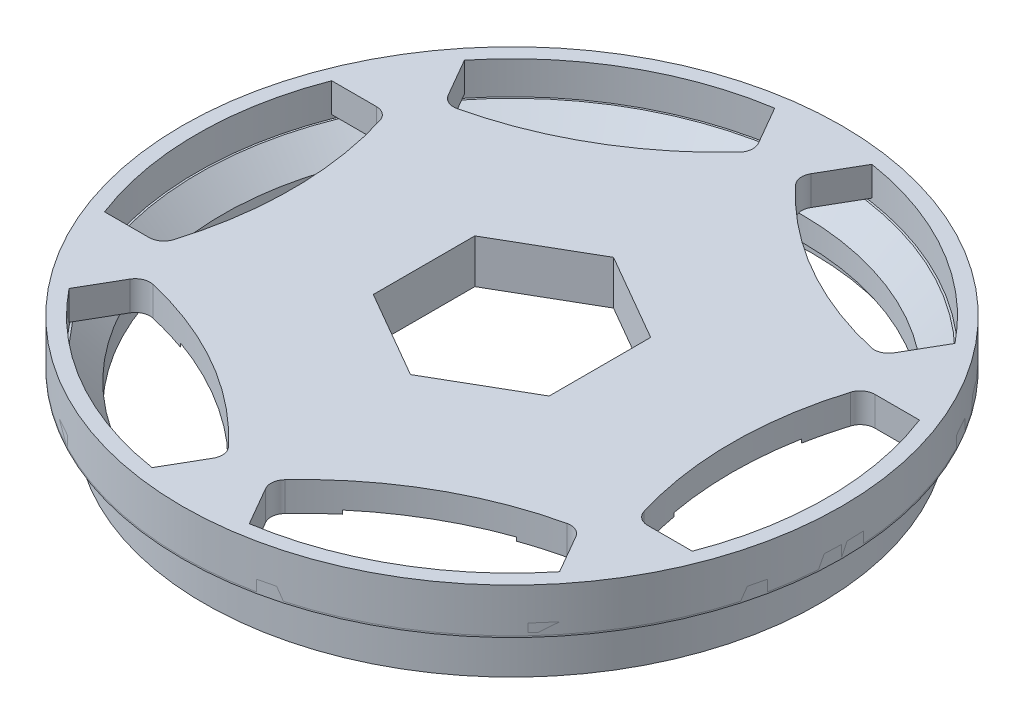
from build123d import *

# Parameters (mm, degrees)
SKIZZE1_R                            = 44
AUFSATZ_LINEAR_AUSTRAGEN1_DEPTH      = 4
SCHNITT_LINEAR_START                 = -10
SCHNITT_LINEAR_AUSTRAGEN2_DEPTH      = 10
SKIZZE4_R                            = 21.007106764
AUFSATZ_LINEAR_AUSTRAGEN4_DEPTH      = 6
KREISMUSTER1_COUNT                   = 6
SCHNITT_LINEAR_AUSTRAGEN3_DEPTH      = 4
SCHNITT_LINEAR_AUSTRAGEN3_DEPTH_BACK = 10
VERRUNDUNG1_R                        = 2
SKIZZE8_R                            = 45
SKIZZE8_R_2                          = 43
AUFSATZ_LINEAR_AUSTRAGEN2_DEPTH      = 6
AUFSATZ_LINEAR_AUSTRAGEN3_DEPTH      = 7
AUFSATZ_LINEAR_AUSTRAGEN3_DEPTH_BACK = 1.5
SKIZZE9_R                            = 45
SKIZZE9_R_2                          = 39.5
FASE1_SIZE                           = 3.25
SKIZZE7_R                            = 32
SKIZZE7_R_2                          = 21.5
SCHNITT_LINEAR_AUSTRAGEN7_DEPTH      = 0.5
SKIZZE10_R                           = 50
SKIZZE10_R_2                         = 42
SCHNITT_LINEAR_AUSTRAGEN9_DEPTH      = 6
SKIZZE11_R                           = 40.9
SKIZZE11_R_2                         = 30
SCHNITT_LINEAR_AUSTRAGEN10_DEPTH     = 2
FASE2_SIZE                           = 0.803847577
FASE2_SIZE_2                         = 3
FASE3_SIZE                           = 2
VERRUNDUNG2_R                        = 1


# Some blends are built 0.0001 mm under size
with BuildPart() as part:
    # Skizze1 → Aufsatz-Linear austragen1 (new body)
    with BuildSketch(Plane(origin=(0, 0, 0), x_dir=(1, 0, 0), z_dir=(0, 1, 0))):
        with Locations(Location((0, 0, 0), (0, 0, 270))):
            Circle(SKIZZE1_R)
    extrude(amount=AUFSATZ_LINEAR_AUSTRAGEN1_DEPTH)

    # Skizze2 → Schnitt-Linear austragen2 (cut)
    with BuildSketch(Plane(origin=(0, 4, 0), x_dir=(1, 0, 0), z_dir=(0, 1, 0)).offset(SCHNITT_LINEAR_START)):
        with BuildLine():
            ThreePointArc((-30, 0), (-30.647234858, 7.855929826), (-32.571484726, 15.5))
            Line((-32.571484726, 15.5), (-41.179485184, 15.5))
            ThreePointArc((-41.179485184, 15.5), (-44, 0), (-41.179485184, -15.5))
            Line((-41.179485184, -15.5), (-32.571484726, -15.5))
            ThreePointArc((-32.571484726, -15.5), (-30.647234858, -7.855929826), (-30, 0))
        make_face()
    schnitt_linear_austragen2 = extrude(amount=SCHNITT_LINEAR_AUSTRAGEN2_DEPTH, mode=Mode.SUBTRACT)

    # Skizze4 → Aufsatz-Linear austragen4 (add)
    with BuildSketch(Plane(origin=(0, 4, 0), x_dir=(1, 0, 0), z_dir=(0, 1, 0))):
        with Locations(Location((0, 0, 0), (0, 0, 270))):
            Circle(SKIZZE4_R)
    extrude(amount=-AUFSATZ_LINEAR_AUSTRAGEN4_DEPTH)

    # Kreismuster1: Schnitt-Linear austragen2 ×6 about axis
    kreismuster1_axis = Axis((0, 0, 0), (0, 1, 0))
    for i in range(1, KREISMUSTER1_COUNT):
        add(schnitt_linear_austragen2.rotate(kreismuster1_axis, i * 360 / KREISMUSTER1_COUNT), mode=Mode.SUBTRACT)

    # Skizze3 → Schnitt-Linear austragen3 (cut, two sides: drawn at the far end of the back side and taken through both)
    with BuildSketch(Plane.XZ.offset(-SCHNITT_LINEAR_AUSTRAGEN3_DEPTH_BACK)):
        Polygon((12, 6.92820323), (0, 13.856406461), (-12, 6.92820323), (-12, -6.92820323), (0, -13.856406461), (12, -6.92820323), align=None)
    extrude(amount=SCHNITT_LINEAR_AUSTRAGEN3_DEPTH + SCHNITT_LINEAR_AUSTRAGEN3_DEPTH_BACK, mode=Mode.SUBTRACT)

    # Verrundung1
    verrundung1_edges = [part.edges().sort_by_distance(p)[0] for p in [
        (-32.571484726, 2, 15.5),
        (-32.571484726, 2, -15.5),
        (-29.709136122, 2, -20.457733212),
        (-2.862348604, 2, -35.957733212),
        (2.862348604, 2, -35.957733212),
        (29.709136122, 2, -20.457733212),
        (32.571484726, 2, -15.5),
        (32.571484726, 2, 15.5),
        (29.709136122, 2, 20.457733212),
        (2.862348604, 2, 35.957733212),
        (-2.862348604, 2, 35.957733212),
        (-29.709136122, 2, 20.457733212),
    ]]
    fillet(verrundung1_edges, radius=VERRUNDUNG1_R)

    # Skizze8 → Aufsatz-Linear austragen2 (add)
    with BuildSketch(Plane(origin=(0, 4, 0), x_dir=(1, 0, 0), z_dir=(0, 1, 0))):
        with Locations(Location((0, 0, 0), (0, 0, 270))):
            Circle(SKIZZE8_R)
        with Locations(Location((0, 0, 0), (0, 0, 270))):
            Circle(SKIZZE8_R_2, mode=Mode.SUBTRACT)
    extrude(amount=-AUFSATZ_LINEAR_AUSTRAGEN2_DEPTH)

    # Skizze7 → Schnitt-Linear austragen7 (cut)
    with BuildSketch(Plane.XZ):
        Circle(SKIZZE7_R)
        with Locations(Location((0, 0, 0), (0, 0, 270))):
            Circle(SKIZZE7_R_2, mode=Mode.SUBTRACT)
    extrude(amount=-SCHNITT_LINEAR_AUSTRAGEN7_DEPTH, mode=Mode.SUBTRACT)

    # Fase3
    fase3_edges = [part.edges().sort_by_distance(p)[0] for p in [
        (0, -2, -21.007106764),
    ]]
    chamfer(fase3_edges, length=FASE3_SIZE - 0.0001)  # a hair under: the kernel refuses the full size


with BuildPart() as body_2:
    # Skizze9 → Aufsatz-Linear austragen3 (new, two sides: drawn at the far end of the back side and taken through both)
    with BuildSketch(Plane.XZ.offset(2).offset(-AUFSATZ_LINEAR_AUSTRAGEN3_DEPTH_BACK)):
        with Locations(Location((0, 0, 0), (0, 0, 270))):
            Circle(SKIZZE9_R)
        with Locations(Location((0, 0, 0), (0, 0, 270))):
            Circle(SKIZZE9_R_2, mode=Mode.SUBTRACT)
    extrude(amount=AUFSATZ_LINEAR_AUSTRAGEN3_DEPTH + AUFSATZ_LINEAR_AUSTRAGEN3_DEPTH_BACK)

    # Fase1
    fase1_edges = [body_2.edges().sort_by_distance(p)[0] for p in [
        (0, -0.5, 39.5),
    ]]
    chamfer(fase1_edges, length=FASE1_SIZE)

    # Skizze10 → Schnitt-Linear austragen9 (cut)
    with BuildSketch(Plane.XZ.offset(9)):
        Circle(SKIZZE10_R)
        with Locations(Location((0, 0, 0), (0, 0, 270))):
            Circle(SKIZZE10_R_2, mode=Mode.SUBTRACT)
    extrude(amount=-SCHNITT_LINEAR_AUSTRAGEN9_DEPTH, mode=Mode.SUBTRACT)

    # Skizze11 → Schnitt-Linear austragen10 (cut)
    with BuildSketch(Plane.XZ.offset(9)):
        with Locations(Location((0, 0, 0), (0, 0, 270))):
            Circle(SKIZZE11_R)
        with Locations((-1.948563864, 1.772578218)):
            Circle(SKIZZE11_R_2, mode=Mode.SUBTRACT)
    extrude(amount=-SCHNITT_LINEAR_AUSTRAGEN10_DEPTH, mode=Mode.SUBTRACT)

    # Fase2
    # the kernel refuses this chamfer: 3, 0.803847577 mm, written as the material it takes off along each edge
    with BuildSketch(Plane(origin=(0, -3, 0), x_dir=(0, 0, -1), z_dir=(-1, 0, 0))) as fase2_piece_1_section:
        Polygon((45, -FASE2_SIZE), (45 - FASE2_SIZE_2, 0), (45, 0), align=None)
    fase2_piece_1 = revolve(axis=Axis((0, -3, 0), (0, -1, 0)), mode=Mode.PRIVATE)
    fase2_piece_1 = fase2_piece_1 - Plane(origin=(0, -2.653988874, 0), x_dir=(0, 0, -1), z_dir=(0, -1, 0)) * Cylinder(42, 180, mode=Mode.PRIVATE)
    add(fase2_piece_1, mode=Mode.SUBTRACT)

    # Verrundung2
    verrundung2_edges = [body_2.edges().sort_by_distance(p)[0] for p in [
        (0, -3, 42),
    ]]
    fillet(verrundung2_edges, radius=VERRUNDUNG2_R)


solid = Compound([part.part, body_2.part])
